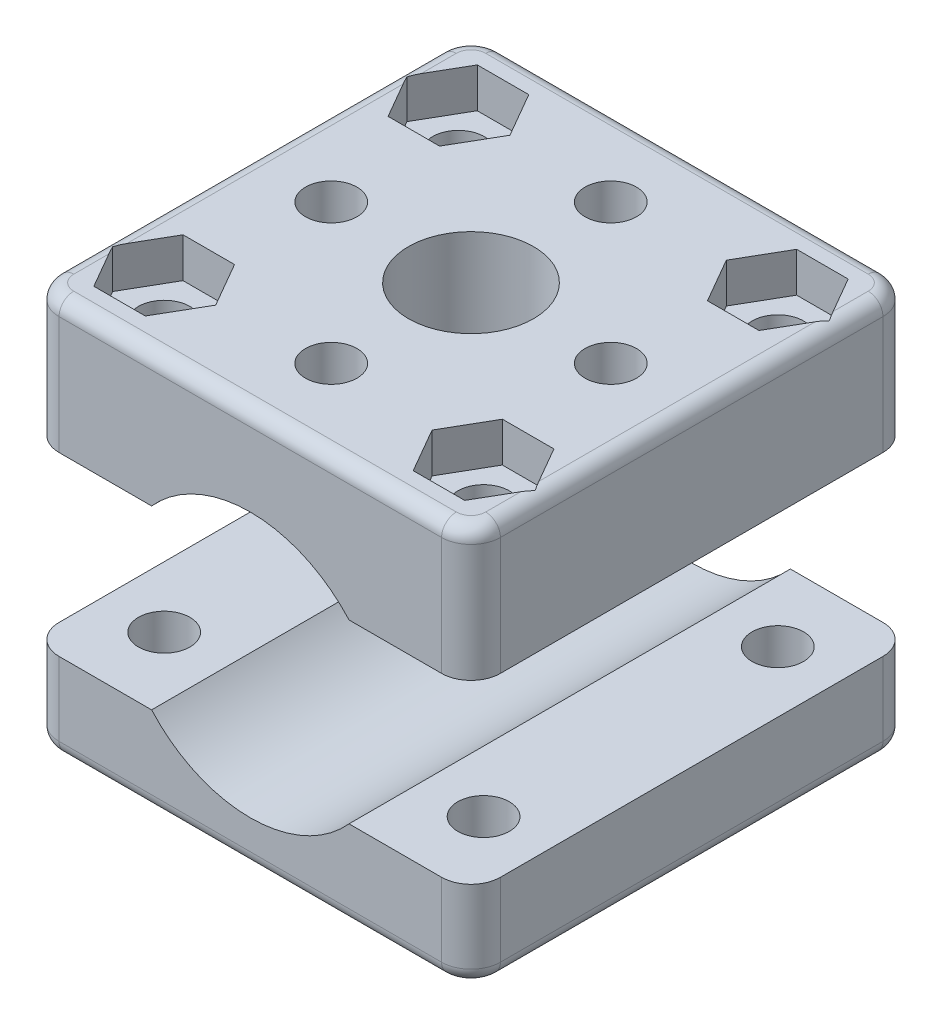
from build123d import *

# Parameters (mm, degrees)
MORSA_DEPTH                         = 15
MORSA_DEPTH_BACK                    = 15
MORSA_2_DEPTH                       = 15
MORSA_2_DEPTH_BACK                  = 15
SCHIZZO2_R                          = 1.75
FORIVITIMORSA_DEPTH                 = 35.336569427
FORIVITIMOTORE_REACH                = 36.337
SCHIZZO4_R                          = 1.75
SCHIZZO5_R                          = 1.75
FOROESAGONALEPIASTRE_DEPTH          = 2.7
SCHIZZO6_R                          = 3.25
SVASATURAVITIINFERIORI_DEPTH        = 3
SCHIZZO7_R                          = 3.25
SVASATURAVITIMOTORIALTE_DEPTH       = 3
SVASATURAVITIMOTORIBASSE_DEPTH      = 3
SVASATURAVITIMOTORIBASSE_DEPTH_BACK = 1
SCHIZZO8_R                          = 3.25
FOROMOTORE_REACH                    = 36.337
FOROMOTORE_END_RADIUS               = 9
SCHIZZO9_R                          = 4.25
RACCORDOVERTICALEUP_R               = 2
RACCORDOVERTICALEDOWN_R             = 2
RACCORDOORIZZONTALEUP_R             = 1
RACCORDOORIZZONTALEDOWN_R           = 1


with BuildPart() as part:
    # Schizzo1 → Morsa (new, two sides: drawn at the far end of the back side and taken through both)
    with BuildSketch(Plane.XY.offset(-MORSA_DEPTH_BACK)):
        with BuildLine():
            Line((-15, 12), (-15, 6))
            Line((-15, 6), (-6.708203932, 6))
            ThreePointArc((-6.708203932, 6), (0, 9), (6.708203932, 6))
            Line((6.708203932, 6), (15, 6))
            Line((15, 6), (15, 12))
            Line((15, 12), (15, 15))
            Line((15, 15), (-15, 15))
            Line((-15, 15), (-15, 12))
        make_face()
    extrude(amount=MORSA_DEPTH + MORSA_DEPTH_BACK)


with BuildPart() as body_2:
    # Schizzo1 → Morsa 2 (new, two sides: drawn at the far end of the back side and taken through both)
    with BuildSketch(Plane.XY.offset(-MORSA_2_DEPTH_BACK)):
        with BuildLine():
            Line((15, -6), (6.708203932, -6))
            ThreePointArc((6.708203932, -6), (0, -9), (-6.708203932, -6))
            Line((-6.708203932, -6), (-15, -6))
            Line((-15, -6), (-15, -12))
            Line((-15, -12), (15, -12))
            Line((15, -12), (15, -6))
        make_face()
    extrude(amount=MORSA_2_DEPTH + MORSA_2_DEPTH_BACK)


with BuildPart() as forivitimorsa_tool:
    # Schizzo2 → ForiVitiMorsa (new, through all)
    with BuildSketch(Plane(origin=(0, 15, 0), x_dir=(1, 0, 0), z_dir=(0, 1, 0))):
        with Locations(Location((-10.854101966, 10, 0), (0, 0, 270))):
            Circle(SCHIZZO2_R)
        with Locations(Location((10.854101966, 10, 0), (0, 0, 180))):
            Circle(SCHIZZO2_R)
        with Locations(Location((-10.854101966, -10, 0), (0, 0, 180))):
            Circle(SCHIZZO2_R)
        with Locations(Location((10.854101966, -10, 0), (0, 0, 270))):
            Circle(SCHIZZO2_R)
    extrude(amount=-FORIVITIMORSA_DEPTH)


with BuildPart() as part_1:
    add(part.part)

    # ForiVitiMorsa: cut by forivitimorsa_tool
    add(forivitimorsa_tool.part, mode=Mode.SUBTRACT)

    # ForiVitiMotore: up to this face of the body (flat: up to its plane)
    forivitimotore_end = Plane(part_1.part.faces().sort_by_distance((10.854101966, 6, 0))[0])
    # Schizzo4 → ForiVitiMotore (cut, up to the picked face)
    with BuildSketch(Plane(origin=(0, 15, 0), x_dir=(1, 0, 0), z_dir=(0, 1, 0)), mode=Mode.PRIVATE) as forivitimotore_sk1:
        with Locations(Location((0, -9.5, 0), (0, 0, 270))):
            Circle(SCHIZZO4_R)
    forivitimotore_tool1 = split(extrude(forivitimotore_sk1.sketch, amount=-FORIVITIMOTORE_REACH, mode=Mode.PRIVATE), bisect_by=forivitimotore_end, keep=Keep.BOTH, mode=Mode.PRIVATE)
    # Schizzo4 → ForiVitiMotore (cut, up to the picked face)
    with BuildSketch(Plane(origin=(0, 15, 0), x_dir=(1, 0, 0), z_dir=(0, 1, 0)), mode=Mode.PRIVATE) as forivitimotore_sk2:
        with Locations(Location((9.5, 0, 0), (0, 0, 270))):
            Circle(SCHIZZO4_R)
    forivitimotore_tool2 = split(extrude(forivitimotore_sk2.sketch, amount=-FORIVITIMOTORE_REACH, mode=Mode.PRIVATE), bisect_by=forivitimotore_end, keep=Keep.BOTH, mode=Mode.PRIVATE)
    # Schizzo4 → ForiVitiMotore (cut, up to the picked face)
    with BuildSketch(Plane(origin=(0, 15, 0), x_dir=(1, 0, 0), z_dir=(0, 1, 0)), mode=Mode.PRIVATE) as forivitimotore_sk3:
        with Locations(Location((-9.5, 0, 0), (0, 0, 270))):
            Circle(SCHIZZO4_R)
    forivitimotore_tool3 = split(extrude(forivitimotore_sk3.sketch, amount=-FORIVITIMOTORE_REACH, mode=Mode.PRIVATE), bisect_by=forivitimotore_end, keep=Keep.BOTH, mode=Mode.PRIVATE)
    # Schizzo4 → ForiVitiMotore (cut, up to the picked face)
    with BuildSketch(Plane(origin=(0, 15, 0), x_dir=(1, 0, 0), z_dir=(0, 1, 0)), mode=Mode.PRIVATE) as forivitimotore_sk4:
        with Locations(Location((0, 9.5, 0), (0, 0, 270))):
            Circle(SCHIZZO4_R)
    forivitimotore_tool4 = split(extrude(forivitimotore_sk4.sketch, amount=-FORIVITIMOTORE_REACH, mode=Mode.PRIVATE), bisect_by=forivitimotore_end, keep=Keep.BOTH, mode=Mode.PRIVATE)
    add(forivitimotore_tool1.solids().sort_by(Axis((0, 15, 9.5), (0, -1, 0)))[0], mode=Mode.SUBTRACT)
    add(forivitimotore_tool2.solids().sort_by(Axis((9.5, 15, 0), (0, -1, 0)))[0], mode=Mode.SUBTRACT)
    add(forivitimotore_tool3.solids().sort_by(Axis((-9.5, 15, 0), (0, -1, 0)))[0], mode=Mode.SUBTRACT)
    add(forivitimotore_tool4.solids().sort_by(Axis((0, 15, -9.5), (0, -1, 0)))[0], mode=Mode.SUBTRACT)

    # Schizzo5 → ForoEsagonalePiastre (cut)
    with BuildSketch(Plane(origin=(0, 15, 0), x_dir=(1, 0, 0), z_dir=(0, 1, 0))):
        with Locations(Location((9.5, 0, 0), (0, 0, 270))):
            Circle(SCHIZZO5_R)
        with Locations(Location((-9.5, 0, 0), (0, 0, 270))):
            Circle(SCHIZZO5_R)
        Polygon((-9.104101966, -13.031088913), (-7.354101966, -10), (-9.104101966, -6.968911087), (-12.604101966, -6.968911087), (-14.354101966, -10), (-12.604101966, -13.031088913), align=None)
        Polygon((9.104101966, -6.968911087), (7.354101966, -10), (9.104101966, -13.031088913), (12.604101966, -13.031088913), (14.354101966, -10), (12.604101966, -6.968911087), align=None)
        Polygon((9.104101966, 6.968911087), (12.604101966, 6.968911087), (14.354101966, 10), (12.604101966, 13.031088913), (9.104101966, 13.031088913), (7.354101966, 10), align=None)
        Polygon((-14.354101966, 10), (-12.604101966, 6.968911087), (-9.104101966, 6.968911087), (-7.354101966, 10), (-9.104101966, 13.031088913), (-12.604101966, 13.031088913), align=None)
    extrude(amount=-FOROESAGONALEPIASTRE_DEPTH, mode=Mode.SUBTRACT)

    # Schizzo7 → SvasaturaVitiMotoriAlte (cut)
    with BuildSketch(Plane.XZ.offset(-6)):
        with Locations(Location((9.5, 0, 0), (0, 0, 270))):
            Circle(SCHIZZO7_R)
        with Locations(Location((-9.5, 0, 0), (0, 0, 270))):
            Circle(SCHIZZO7_R)
    extrude(amount=-SVASATURAVITIMOTORIALTE_DEPTH, mode=Mode.SUBTRACT)

    # Schizzo8 → SvasaturaVitiMotoriBasse (cut, two sides: drawn at the far end of the back side and taken through both)
    with BuildSketch(Plane(origin=(0, 9, 0), x_dir=(1, 0, 0), z_dir=(0, 1, 0)).offset(-SVASATURAVITIMOTORIBASSE_DEPTH_BACK)):
        with Locations(Location((0, 9.5, 0), (0, 0, 270))):
            Circle(SCHIZZO8_R)
        with Locations(Location((0, -9.5, 0), (0, 0, 270))):
            Circle(SCHIZZO8_R)
    extrude(amount=SVASATURAVITIMOTORIBASSE_DEPTH + SVASATURAVITIMOTORIBASSE_DEPTH_BACK, mode=Mode.SUBTRACT)

    # ForoMotore: up to this cylinder (the profile starts outside it)
    foromotore_end = Plane(origin=(0, 0, 0), z_dir=(0, 0, 1)) * Cylinder(FOROMOTORE_END_RADIUS, 91.674, mode=Mode.PRIVATE)
    # Schizzo9 → ForoMotore (cut, up to the surface)
    with BuildSketch(Plane(origin=(0, 15, 0), x_dir=(1, 0, 0), z_dir=(0, 1, 0)), mode=Mode.PRIVATE) as foromotore_sk1:
        with Locations(Location((0, 0, 0), (0, 0, 270))):
            Circle(SCHIZZO9_R)
    foromotore_tool1 = extrude(foromotore_sk1.sketch, amount=-FOROMOTORE_REACH, mode=Mode.PRIVATE) - foromotore_end
    add(foromotore_tool1.solids().sort_by_distance((0, 15, 0))[0], mode=Mode.SUBTRACT)

    # RaccordoVerticaleUp
    raccordoverticaleup_edges = [part_1.edges().sort_by_distance(p)[0] for p in [
        (-15, 10.5, 15),
        (15, 10.5, -15),
        (15, 10.5, 15),
        (-15, 10.5, -15),
    ]]
    fillet(raccordoverticaleup_edges, radius=RACCORDOVERTICALEUP_R)

    # RaccordoOrizzontaleUp
    # the kernel refuses this fillet: 1 mm, written as the material it takes off along each edge
    with BuildSketch(Plane(origin=(13, 15, 15), x_dir=(0, -1, 0), z_dir=(-1, 0, 0)), Plane(origin=(-15, 15, -13), x_dir=(1, 0, 0), z_dir=(0, 0, 1)), Plane(origin=(15, 15, -13), x_dir=(0, -1, 0), z_dir=(0, 0, 1))) as raccordoorizzontaleup_piece_1:
        with BuildLine():
            CenterArc((RACCORDOORIZZONTALEUP_R, -RACCORDOORIZZONTALEUP_R), RACCORDOORIZZONTALEUP_R, 90, 90)
            Line((0, -RACCORDOORIZZONTALEUP_R), (0, 0))
            Line((0, 0), (RACCORDOORIZZONTALEUP_R, 0))
        make_face()
    extrude(amount=26, mode=Mode.SUBTRACT)
    with BuildSketch(Plane(origin=(13, 15, -15), x_dir=(0, -1, 0), z_dir=(-1, 0, 0))) as raccordoorizzontaleup_piece_2:
        with BuildLine():
            CenterArc((RACCORDOORIZZONTALEUP_R, RACCORDOORIZZONTALEUP_R), RACCORDOORIZZONTALEUP_R, 180, 90)
            Line((0, RACCORDOORIZZONTALEUP_R), (0, 0))
            Line((0, 0), (RACCORDOORIZZONTALEUP_R, 0))
        make_face()
    extrude(amount=26, mode=Mode.SUBTRACT)
    with BuildSketch(Plane(origin=(13, 15, -13), x_dir=(0, 0, -1), z_dir=(-1, 0, 0))) as raccordoorizzontaleup_piece_3:
        with BuildLine():
            CenterArc((2 - RACCORDOORIZZONTALEUP_R, RACCORDOORIZZONTALEUP_R), RACCORDOORIZZONTALEUP_R, 270, 90)
            Line((2 - RACCORDOORIZZONTALEUP_R, 0), (2, 0))
            Line((2, 0), (2, RACCORDOORIZZONTALEUP_R))
        make_face()
    revolve(axis=Axis((13, 15, -13), (0, -1, 0)), revolution_arc=90, mode=Mode.SUBTRACT)
    with BuildSketch(Plane(origin=(13, 15, 13), x_dir=(1, 0, 0), z_dir=(0, 0, -1))) as raccordoorizzontaleup_piece_4:
        with BuildLine():
            CenterArc((2 - RACCORDOORIZZONTALEUP_R, RACCORDOORIZZONTALEUP_R), RACCORDOORIZZONTALEUP_R, 270, 90)
            Line((2 - RACCORDOORIZZONTALEUP_R, 0), (2, 0))
            Line((2, 0), (2, RACCORDOORIZZONTALEUP_R))
        make_face()
    revolve(axis=Axis((13, 15, 13), (0, -1, 0)), revolution_arc=90, mode=Mode.SUBTRACT)
    with BuildSketch(Plane(origin=(-13, 15, -13), x_dir=(0, 0, -1), z_dir=(1, 0, 0))) as raccordoorizzontaleup_piece_5:
        with BuildLine():
            CenterArc((2 - RACCORDOORIZZONTALEUP_R, -RACCORDOORIZZONTALEUP_R), RACCORDOORIZZONTALEUP_R, 0, 90)
            Line((2, -RACCORDOORIZZONTALEUP_R), (2, 0))
            Line((2, 0), (2 - RACCORDOORIZZONTALEUP_R, 0))
        make_face()
    revolve(axis=Axis((-13, 15, -13), (0, 1, 0)), revolution_arc=90, mode=Mode.SUBTRACT)
    with BuildSketch(Plane(origin=(-13, 15, 13), x_dir=(0, 0, 1), z_dir=(1, 0, 0))) as raccordoorizzontaleup_piece_6:
        with BuildLine():
            CenterArc((2 - RACCORDOORIZZONTALEUP_R, RACCORDOORIZZONTALEUP_R), RACCORDOORIZZONTALEUP_R, 270, 90)
            Line((2, RACCORDOORIZZONTALEUP_R), (2, 0))
            Line((2, 0), (2 - RACCORDOORIZZONTALEUP_R, 0))
        make_face()
    revolve(axis=Axis((-13, 15, 13), (0, -1, 0)), revolution_arc=90, mode=Mode.SUBTRACT)


with BuildPart() as body_2_1:
    add(body_2.part)

    # ForiVitiMorsa: cut by forivitimorsa_tool
    add(forivitimorsa_tool.part, mode=Mode.SUBTRACT)

    # Schizzo6 → SvasaturaVitiInferiori (cut)
    with BuildSketch(Plane.XZ.offset(12)):
        with Locations(Location((-10.854101966, 10, 0), (0, 0, 270))):
            Circle(SCHIZZO6_R)
        with Locations(Location((10.854101966, 10, 0), (0, 0, 270))):
            Circle(SCHIZZO6_R)
        with Locations(Location((-10.854101966, -10, 0), (0, 0, 270))):
            Circle(SCHIZZO6_R)
        with Locations(Location((10.854101966, -10, 0), (0, 0, 270))):
            Circle(SCHIZZO6_R)
    extrude(amount=-SVASATURAVITIINFERIORI_DEPTH, mode=Mode.SUBTRACT)

    # RaccordoVerticaleDown
    raccordoverticaledown_edges = [body_2_1.edges().sort_by_distance(p)[0] for p in [
        (15, -9, 15),
        (-15, -9, 15),
        (-15, -9, -15),
        (15, -9, -15),
    ]]
    fillet(raccordoverticaledown_edges, radius=RACCORDOVERTICALEDOWN_R)

    # RaccordoOrizzontaleDown
    # the kernel refuses this fillet: 1 mm, written as the material it takes off along each edge
    with BuildSketch(Plane(origin=(15, -12, 13), x_dir=(0, 1, 0), z_dir=(0, 0, -1)), Plane(origin=(-13, -12, 15), x_dir=(0, 1, 0), z_dir=(1, 0, 0)), Plane(origin=(-15, -12, 13), x_dir=(1, 0, 0), z_dir=(0, 0, -1))) as raccordoorizzontaledown_piece_1:
        with BuildLine():
            CenterArc((RACCORDOORIZZONTALEDOWN_R, -RACCORDOORIZZONTALEDOWN_R), RACCORDOORIZZONTALEDOWN_R, 90, 90)
            Line((0, -RACCORDOORIZZONTALEDOWN_R), (0, 0))
            Line((0, 0), (RACCORDOORIZZONTALEDOWN_R, 0))
        make_face()
    extrude(amount=26, mode=Mode.SUBTRACT)
    with BuildSketch(Plane(origin=(-13, -12, -15), x_dir=(0, 1, 0), z_dir=(1, 0, 0))) as raccordoorizzontaledown_piece_2:
        with BuildLine():
            CenterArc((RACCORDOORIZZONTALEDOWN_R, RACCORDOORIZZONTALEDOWN_R), RACCORDOORIZZONTALEDOWN_R, 180, 90)
            Line((0, RACCORDOORIZZONTALEDOWN_R), (0, 0))
            Line((0, 0), (RACCORDOORIZZONTALEDOWN_R, 0))
        make_face()
    extrude(amount=26, mode=Mode.SUBTRACT)
    with BuildSketch(Plane(origin=(-13, -12, 13), x_dir=(0, 0, 1), z_dir=(1, 0, 0))) as raccordoorizzontaledown_piece_3:
        with BuildLine():
            CenterArc((2 - RACCORDOORIZZONTALEDOWN_R, -RACCORDOORIZZONTALEDOWN_R), RACCORDOORIZZONTALEDOWN_R, 0, 90)
            Line((2, -RACCORDOORIZZONTALEDOWN_R), (2, 0))
            Line((2, 0), (2 - RACCORDOORIZZONTALEDOWN_R, 0))
        make_face()
    revolve(axis=Axis((-13, -12, 13), (0, -1, 0)), revolution_arc=90, mode=Mode.SUBTRACT)
    with BuildSketch(Plane(origin=(13, -12, 13), x_dir=(1, 0, 0), z_dir=(0, 0, -1))) as raccordoorizzontaledown_piece_4:
        with BuildLine():
            CenterArc((2 - RACCORDOORIZZONTALEDOWN_R, -RACCORDOORIZZONTALEDOWN_R), RACCORDOORIZZONTALEDOWN_R, 0, 90)
            Line((2 - RACCORDOORIZZONTALEDOWN_R, 0), (2, 0))
            Line((2, 0), (2, -RACCORDOORIZZONTALEDOWN_R))
        make_face()
    revolve(axis=Axis((13, -12, 13), (0, -1, 0)), revolution_arc=90, mode=Mode.SUBTRACT)
    with BuildSketch(Plane(origin=(-13, -12, -13), x_dir=(0, 0, -1), z_dir=(1, 0, 0))) as raccordoorizzontaledown_piece_5:
        with BuildLine():
            CenterArc((2 - RACCORDOORIZZONTALEDOWN_R, RACCORDOORIZZONTALEDOWN_R), RACCORDOORIZZONTALEDOWN_R, 270, 90)
            Line((2, RACCORDOORIZZONTALEDOWN_R), (2, 0))
            Line((2, 0), (2 - RACCORDOORIZZONTALEDOWN_R, 0))
        make_face()
    revolve(axis=Axis((-13, -12, -13), (0, 1, 0)), revolution_arc=90, mode=Mode.SUBTRACT)
    with BuildSketch(Plane(origin=(13, -12, -13), x_dir=(1, 0, 0), z_dir=(0, 0, 1))) as raccordoorizzontaledown_piece_6:
        with BuildLine():
            CenterArc((2 - RACCORDOORIZZONTALEDOWN_R, RACCORDOORIZZONTALEDOWN_R), RACCORDOORIZZONTALEDOWN_R, 270, 90)
            Line((2 - RACCORDOORIZZONTALEDOWN_R, 0), (2, 0))
            Line((2, 0), (2, RACCORDOORIZZONTALEDOWN_R))
        make_face()
    revolve(axis=Axis((13, -12, -13), (0, 1, 0)), revolution_arc=90, mode=Mode.SUBTRACT)


solid = Compound([part_1.part, body_2_1.part])
